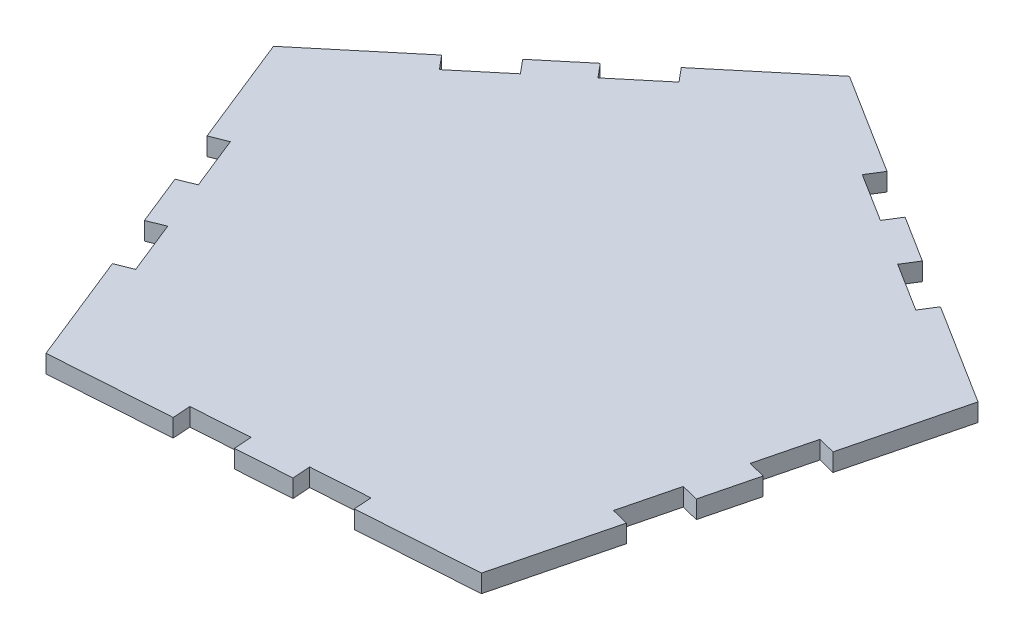
from build123d import *

# Parameters (mm, degrees)
BOSS_EXTRUDE1_DEPTH = 3.18
CUT_EXTRUDE1_DEPTH  = 87.044973388
CIRPATTERN1_COUNT   = 5


with BuildPart() as part:
    # Sketch1 → Boss-Extrude1 (new body)
    with BuildSketch(Plane(origin=(0, 0, 0), x_dir=(1, 0, 0), z_dir=(0, 1, 0))):
        Polygon((-59.925822748, 15.118064705), (-32.896231583, -52.321105303), (39.594833528, -47.454286112), (57.367184482, 22.992743574), (-4.139963679, 61.664583135), align=None)
    extrude(amount=BOSS_EXTRUDE1_DEPTH)

    # Sketch2 → Cut-Extrude1 (cut, through all)
    with BuildSketch(Plane.XZ):
        Polygon((-52.0324066, 4.576107889), (-49.080665272, 3.393051198), (-45.278514523, 12.879465151), (-48.230255851, 14.062521842), align=None)
        Polygon((-44.59179848, 23.140518756), (-40.789647731, 32.626932708), (-37.837906404, 31.443876017), (-41.640057153, 21.957462065), align=None)
    cut_extrude1 = extrude(amount=-CUT_EXTRUDE1_DEPTH, mode=Mode.SUBTRACT)

    # CirPattern1: Cut-Extrude1 ×5 about axis
    cirpattern1_axis = Axis((0, 3.339, 0), (0, -1, 0))
    for i in range(1, CIRPATTERN1_COUNT):
        add(cut_extrude1.rotate(cirpattern1_axis, i * 360 / CIRPATTERN1_COUNT), mode=Mode.SUBTRACT)


solid = part.part
